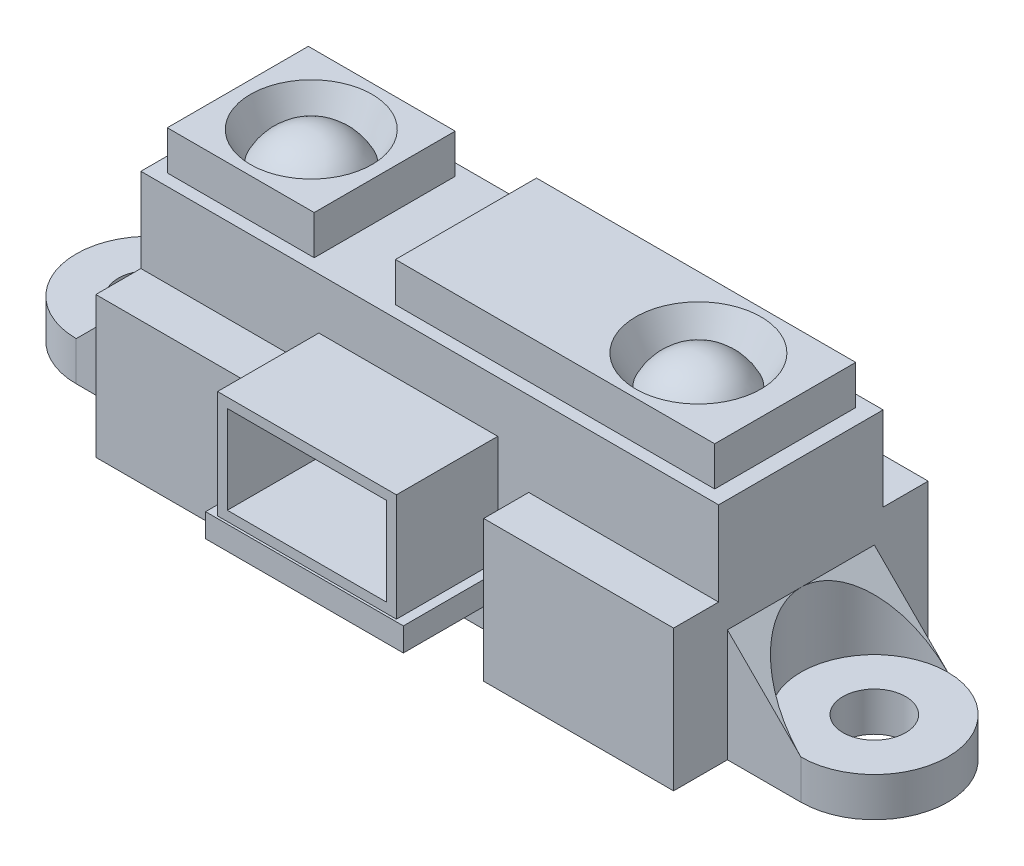
from build123d import *

# Parameters (mm, degrees)
BOSS_EXTRUDE1_DEPTH   = 7.2
SKETCH1_3_R           = 3.75
SKETCH1_3_R_2         = 1.6
BOSS_EXTRUDE2_DEPTH   = 2
BOSS_EXTRUDE2_2_DEPTH = 2
BOSS_EXTRUDE3_DEPTH   = 2
BOSS_EXTRUDE4_DEPTH   = 7.5
SKETCH3_R             = 3.75
CUT_EXTRUDE6_DEPTH    = 12
BOSS_EXTRUDE5_DEPTH   = 7.5
SKETCH5_R             = 3.75
CUT_EXTRUDE7_DEPTH    = 7.5
SKETCH6_W             = 29.5
SKETCH6_H             = 8.4
BOSS_EXTRUDE6_DEPTH   = 4.3
SKETCH7_W             = 7.5
SKETCH7_H             = 7.2
SKETCH7_W_2           = 16.3
BOSS_EXTRUDE7_DEPTH   = 2
SKETCH8_W             = 10.1
SKETCH8_H             = 2.3
CUT_EXTRUDE8_DEPTH    = 12
SKETCH9_W             = 10.1
SKETCH9_H             = 1.2
BOSS_EXTRUDE8_DEPTH   = 6.4
SKETCH11_W            = 9.1347476
SKETCH11_H            = 5.173710516
BOSS_EXTRUDE11_DEPTH  = 5.5
SKETCH12_R            = 3.106234899
CUT_EXTRUDE10_DEPTH   = 1.5
CUT_EXTRUDE10_DRAFT   = -25
SKETCH13_R            = 3.196774454
CUT_EXTRUDE11_DEPTH   = 1.5
CUT_EXTRUDE11_DRAFT   = -29
SKETCH14_W            = 8.1347476
SKETCH14_H            = 4.5
CUT_EXTRUDE12_DEPTH   = 4.5


# Read off the part's stored shape, not the designer's step: Dome1, Dome2
with BuildPart() as part:
    # Sketch1 → Boss-Extrude1 (new body)
    with BuildSketch(Plane(origin=(0, 0, 0), x_dir=(1, 0, 0), z_dir=(0, 1, 0))):
        Polygon((14.75, 0), (-14.75, 0), (-14.75, -3.75), (-14.75, -6.5), (14.75, -6.5), (14.75, -3.75), align=None)
        Polygon((-14.75, 3.75), (-14.75, 0), (14.75, 0), (14.75, 3.75), (14.75, 6.5), (-14.75, 6.5), align=None)
    extrude(amount=BOSS_EXTRUDE1_DEPTH)



with BuildPart() as body_2:
    # Sketch1<3> → Boss-Extrude2 (new body)
    with BuildSketch(Plane(origin=(0, 0, 0), x_dir=(1, 0, 0), z_dir=(0, 1, 0))):
        with Locations(Location((-18.5, 0, 0), (0, 0, 270))):
            Circle(SKETCH1_3_R)
        with Locations(Location((-18.5, 0, 0), (0, 0, 270))):
            Circle(SKETCH1_3_R_2, mode=Mode.SUBTRACT)
    extrude(amount=BOSS_EXTRUDE2_DEPTH)


with BuildPart() as body_3:
    # Sketch1<3> → Boss-Extrude2 2 (new body)
    with BuildSketch(Plane(origin=(0, 0, 0), x_dir=(1, 0, 0), z_dir=(0, 1, 0))):
        with Locations(Location((18.5, 0, 0), (0, 0, 270))):
            Circle(SKETCH1_3_R)
        with Locations(Location((18.5, 0, 0), (0, 0, 270))):
            Circle(SKETCH1_3_R_2, mode=Mode.SUBTRACT)
    extrude(amount=BOSS_EXTRUDE2_2_DEPTH)


with BuildPart() as part_1:
    add(part.part)

    add(body_2.part)  # Boss-Extrude3 merges body 2

    add(body_3.part)  # Boss-Extrude3 merges body 3
    # Sketch1<4> → Boss-Extrude3 (add)
    with BuildSketch(Plane(origin=(0, 0, 0), x_dir=(1, 0, 0), z_dir=(0, 1, 0))):
        with BuildLine():
            Line((-14.75, -3.75), (-14.75, 0))
            ThreePointArc((-14.75, 0), (-15.848349571, -2.651650429), (-18.5, -3.75))
            Line((-18.5, -3.75), (-14.75, -3.75))
        make_face()
        with BuildLine():
            Line((-14.75, 0), (-14.75, 3.75))
            Line((-14.75, 3.75), (-18.5, 3.75))
            ThreePointArc((-18.5, 3.75), (-15.848349571, 2.651650429), (-14.75, 0))
        make_face()
        with BuildLine():
            Line((18.5, 3.75), (14.75, 3.75))
            Line((14.75, 3.75), (14.75, 0))
            ThreePointArc((14.75, 0), (15.848349571, 2.651650429), (18.5, 3.75))
        make_face()
        with BuildLine():
            ThreePointArc((18.5, -3.75), (15.848349571, -2.651650429), (14.75, 0))
            Line((14.75, 0), (14.75, -3.75))
            Line((14.75, -3.75), (18.5, -3.75))
        make_face()
    extrude(amount=BOSS_EXTRUDE3_DEPTH)

    # Sketch2 → Boss-Extrude4 (add)
    with BuildSketch(Plane.XY.offset(3.75)):
        Polygon((18.5, 2), (14.75, 2), (14.75, 5.75), align=None)
    extrude(amount=-BOSS_EXTRUDE4_DEPTH)

    # Sketch3 → Cut-Extrude6 (cut)
    with BuildSketch(Plane(origin=(0, 2, 0), x_dir=(1, 0, 0), z_dir=(0, 1, 0))):
        with Locations((18.5, 0)):
            Circle(SKETCH3_R)
    extrude(amount=CUT_EXTRUDE6_DEPTH, mode=Mode.SUBTRACT)

    # Sketch4 → Boss-Extrude5 (add)
    with BuildSketch(Plane.XY.offset(3.75)):
        Polygon((-14.75, 5.75), (-18.5, 2), (-14.75, 2), align=None)
    extrude(amount=-BOSS_EXTRUDE5_DEPTH)

    # Sketch5 → Cut-Extrude7 (cut)
    with BuildSketch(Plane(origin=(0, 2, 0), x_dir=(1, 0, 0), z_dir=(0, 1, 0))):
        with Locations((-18.5, 0)):
            Circle(SKETCH5_R)
    extrude(amount=CUT_EXTRUDE7_DEPTH, mode=Mode.SUBTRACT)

    # Sketch6 → Boss-Extrude6 (add)
    with BuildSketch(Plane(origin=(0, 7.2, 0), x_dir=(1, 0, 0), z_dir=(0, 1, 0))):
        Rectangle(SKETCH6_W, SKETCH6_H)
    extrude(amount=BOSS_EXTRUDE6_DEPTH)

    # Sketch7 → Boss-Extrude7 (add)
    with BuildSketch(Plane(origin=(0, 11.5, 0), x_dir=(1, 0, 0), z_dir=(0, 1, 0))):
        with Locations((-10.25, 0)):
            Rectangle(SKETCH7_W, SKETCH7_H)
        with Locations((5.8, 0)):
            Rectangle(SKETCH7_W_2, SKETCH7_H)
    extrude(amount=BOSS_EXTRUDE7_DEPTH)

    # Sketch8 → Cut-Extrude8 (cut)
    with BuildSketch(Plane(origin=(0, 7.2, 0), x_dir=(1, 0, 0), z_dir=(0, 1, 0))):
        with Locations((0.003829246, -5.35)):
            Rectangle(SKETCH8_W, SKETCH8_H)
    extrude(amount=-CUT_EXTRUDE8_DEPTH, mode=Mode.SUBTRACT)

    # Sketch9 → Boss-Extrude8 (add)
    with BuildSketch(Plane.XY.offset(4.2)):
        with Locations((0.003829246, 3.9)):
            Rectangle(SKETCH9_W, SKETCH9_H)
    extrude(amount=BOSS_EXTRUDE8_DEPTH)

    # Sketch11 → Boss-Extrude11 (add)
    with BuildSketch(Plane(origin=(0, 4.5, 0), x_dir=(1, 0, 0), z_dir=(0, 1, 0))):
        with Locations((0.014014126, -7.894862881)):
            Rectangle(SKETCH11_W, SKETCH11_H)
    extrude(amount=BOSS_EXTRUDE11_DEPTH)


with BuildPart() as cut_extrude10_tool:
    # Sketch12 → Cut-Extrude10 (with draft: the straight prism first)
    with BuildSketch(Plane(origin=(0, 13.5, 0), x_dir=(1, 0, 0), z_dir=(0, 1, 0))):
        with Locations((-10.25, 0)):
            Circle(SKETCH12_R)
    extrude(amount=-CUT_EXTRUDE10_DEPTH)
    # Cut-Extrude10: the draft: its side faces are tilted about the plane it starts from
    cut_extrude10_sides = [cut_extrude10_tool.faces().sort_by_distance(p)[0] for p in [
        (-13.356234899, 12.75, 0),
    ]]
    draft(cut_extrude10_sides, Plane(origin=(0, 13.5, 0), x_dir=(1, 0, 0), z_dir=(0, 1, 0)), CUT_EXTRUDE10_DRAFT)


with BuildPart() as part_2:
    add(part_1.part)

    # Cut-Extrude10: cut by cut_extrude10_tool
    add(cut_extrude10_tool.part, mode=Mode.SUBTRACT)


with BuildPart() as cut_extrude11_tool:
    # Sketch13 → Cut-Extrude11 (with draft: the straight prism first)
    with BuildSketch(Plane(origin=(0, 13.5, 0), x_dir=(1, 0, 0), z_dir=(0, 1, 0))):
        with Locations((9.516994158, 0)):
            Circle(SKETCH13_R)
    extrude(amount=-CUT_EXTRUDE11_DEPTH)
    # Cut-Extrude11: the draft: its side faces are tilted about the plane it starts from
    cut_extrude11_sides = [cut_extrude11_tool.faces().sort_by_distance(p)[0] for p in [
        (6.320219704, 12.75, 0),
    ]]
    draft(cut_extrude11_sides, Plane(origin=(0, 13.5, 0), x_dir=(1, 0, 0), z_dir=(0, 1, 0)), CUT_EXTRUDE11_DRAFT)


with BuildPart() as part_3:
    add(part_2.part)

    # Cut-Extrude11: cut by cut_extrude11_tool
    add(cut_extrude11_tool.part, mode=Mode.SUBTRACT)

    # Dome1 outline → Dome1 (revolve)
    with BuildSketch(Plane(origin=(-10.25, 0, 0), x_dir=(1, 0, 0), z_dir=(0, 0, 1))):
        with BuildLine():
            Line((0, 12), (2.406773413, 11.999999998))
            ThreePointArc((2.406773413, 11.999999998), (1.417970228, 13.094302608), (0, 13.5))
            Line((0, 13.5), (0, 12))
        make_face()
    revolve(axis=Axis((-10.25, 0, 0), (0, 1, 0)))

    # Dome2 outline → Dome2 (revolve)
    with BuildSketch(Plane(origin=(9.516994158, 0, 0), x_dir=(1, 0, 0), z_dir=(0, 0, 1))):
        with BuildLine():
            Line((0, 12), (2.365310878, 11.999999998))
            ThreePointArc((2.365310878, 11.999999998), (1.400419183, 13.093385967), (0, 13.5))
            Line((0, 13.5), (0, 12))
        make_face()
    revolve(axis=Axis((9.516994158, 0, 0), (0, 1, 0)))

    # Sketch14 → Cut-Extrude12 (cut)
    with BuildSketch(Plane.XY.offset(10.481718139)):
        with Locations((0.014014126, 7.25)):
            Rectangle(SKETCH14_W, SKETCH14_H)
    extrude(amount=-CUT_EXTRUDE12_DEPTH, mode=Mode.SUBTRACT)


solid = part_3.part
